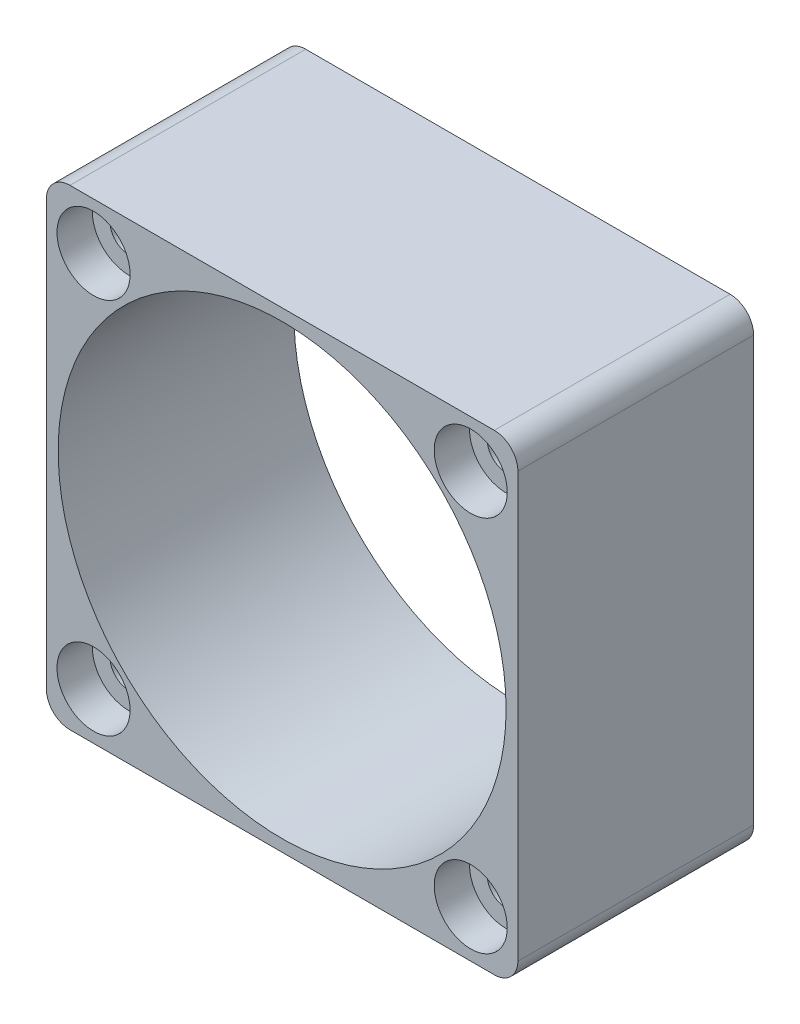
from build123d import *

# Parameters (mm, degrees)
SKETCH1_W           = 40
SKETCH1_H           = 40
BOSS_EXTRUDE1_DEPTH = 20
SKETCH2_R           = 19
SKETCH2_R_2         = 1.6
CUT_EXTRUDE1_DEPTH  = 35.641016151
FILLET1_R           = 2
SKETCH3_R           = 3.1
CUT_EXTRUDE2_DEPTH  = 3


with BuildPart() as part:
    # Sketch1 → Boss-Extrude1 (new body)
    with BuildSketch(Plane.XY):
        Rectangle(SKETCH1_W, SKETCH1_H)
    extrude(amount=BOSS_EXTRUDE1_DEPTH)

    # Sketch2 → Cut-Extrude1 (cut, through all)
    with BuildSketch(Plane.XY.offset(20)):
        Circle(SKETCH2_R)
        with Locations((-16, 16)):
            Circle(SKETCH2_R_2)
        with Locations((16, 16)):
            Circle(SKETCH2_R_2)
        with Locations((16, -16)):
            Circle(SKETCH2_R_2)
        with Locations((-16, -16)):
            Circle(SKETCH2_R_2)
    extrude(amount=-CUT_EXTRUDE1_DEPTH, mode=Mode.SUBTRACT)

    # Fillet1
    fillet1_edges = [part.edges().sort_by_distance(p)[0] for p in [
        (-20, -20, 10),
        (-20, 20, 10),
        (20, -20, 10),
        (20, 20, 10),
    ]]
    fillet(fillet1_edges, radius=FILLET1_R)

    # Sketch3 → Cut-Extrude2 (cut)
    with BuildSketch(Plane.XY.offset(20)):
        with Locations((-16, -16)):
            Circle(SKETCH3_R)
        with Locations((16, -16)):
            Circle(SKETCH3_R)
        with Locations((16, 16)):
            Circle(SKETCH3_R)
        with Locations((-16, 16)):
            Circle(SKETCH3_R)
    extrude(amount=-CUT_EXTRUDE2_DEPTH, mode=Mode.SUBTRACT)


solid = part.part
